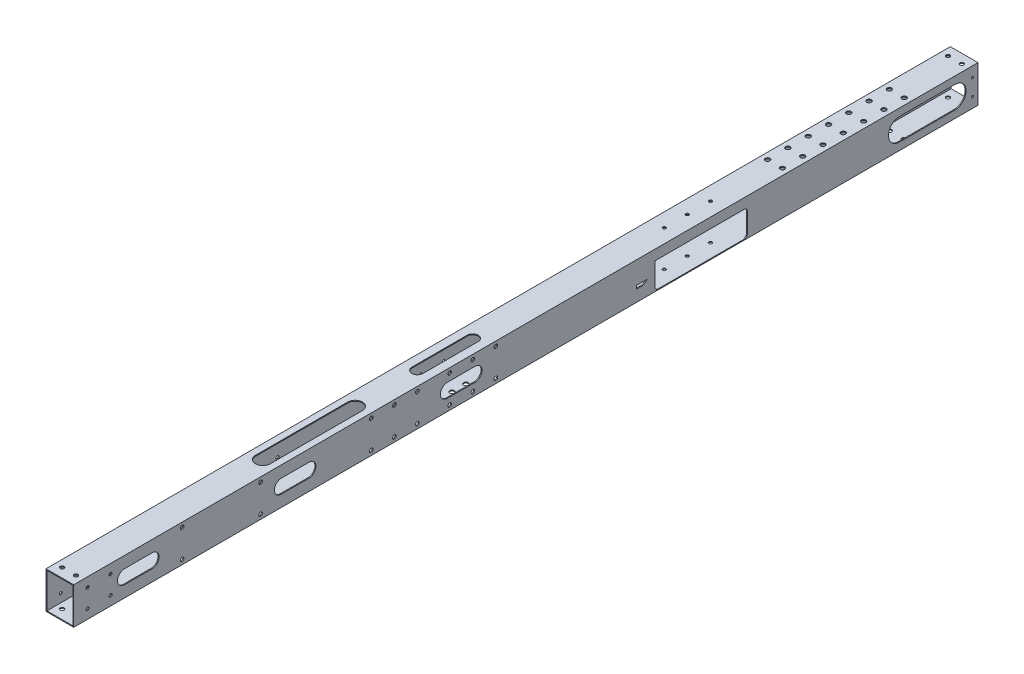
from build123d import *

# Parameters (mm, degrees)
SKETCH_1_W             = 30
SKETCH_1_H             = 40
SKETCH_1_W_2           = 28
SKETCH_1_H_2           = 38
EXTRUDE_1_DEPTH        = 940
SKETCH_5_R             = 2.5
CUT_EXTRUDE_3_DEPTH    = 941.97024395
CUT_EXTRUDE_4_DEPTH    = 1
SKETCH_7_R             = 1.75
CUT_EXTRUDE_5_DEPTH    = 1
SKETCH_17_W            = 30
SKETCH_17_H            = 40
SKETCH_17_W_2          = 28
SKETCH_17_H_2          = 38
EXTRUDE_2_DEPTH        = 20
SKETCH_18_W            = 30
SKETCH_18_H            = 40
SKETCH_18_W_2          = 28
SKETCH_18_H_2          = 38
EXTRUDE_3_DEPTH        = 20
SKETCH_19_R            = 2.1
CUT_EXTRUDE_16_DEPTH   = 961.950050731
SKETCH_20_R            = 1.6
CUT_EXTRUDE_17_DEPTH   = 961.67684473
SKETCH_23_R            = 2.5
CUT_EXTRUDE_19_DEPTH   = 961.950050731
SKETCH_24_R            = 4.5
CUT_EXTRUDE_20_DEPTH   = 10
SKETCH_26_R            = 2
CUT_EXTRUDE_22_DEPTH   = 961.67684473
CUT_EXTRUDE_28_DEPTH   = 10
PATTERN_LINEAR_4_COUNT = 2
PATTERN_LINEAR_4_PITCH = 255
PATTERN_LINEAR_8_COUNT = 2
PATTERN_LINEAR_8_PITCH = 205
PATTERN_LINEAR_9_COUNT = 2
PATTERN_LINEAR_9_PITCH = 230
CUT_EXTRUDE_START      = -20
SKETCH_34_R            = 1.75
CUT_EXTRUDE_29_DEPTH   = 20
SKETCH_35_R            = 1.5
CUT_EXTRUDE_30_DEPTH   = 10
CUT_EXTRUDE_31_DEPTH   = 10
SKETCH_37_R            = 1.65
CUT_EXTRUDE_32_DEPTH   = 52
SKETCH_39_R            = 1.75
CUT_EXTRUDE_33_DEPTH   = 10
SKETCH_40_W            = 100
SKETCH_40_H            = 28
CUT_EXTRUDE_34_DEPTH   = 10
EXTRUDE_5_DEPTH        = 1
SKETCH_43_W            = 38.522995696
SKETCH_43_H            = 13.00002022
EXTRUDE_6_DEPTH        = 1
FILLET_1_R             = 3
CUT_EXTRUDE_35_DEPTH   = 10
SKETCH_45_R            = 1.1
CUT_EXTRUDE_36_DEPTH   = 71
CUT_EXTRUDE_37_DEPTH   = 10


with BuildPart() as part:
    # 草图1 → 凸台-拉伸1 (new body)
    with BuildSketch(Plane.XY):
        Rectangle(SKETCH_1_W, SKETCH_1_H)
        Rectangle(SKETCH_1_W_2, SKETCH_1_H_2, mode=Mode.SUBTRACT)
    extrude(amount=EXTRUDE_1_DEPTH)

    # 草图5 → 切除-拉伸3 (cut, through all)
    with BuildSketch(Plane.XZ.offset(20)):
        with Locations((-8, 53)):
            Circle(SKETCH_5_R)
        with Locations((8, 53)):
            Circle(SKETCH_5_R)
        with Locations((-8, 97)):
            Circle(SKETCH_5_R)
        with Locations((8, 97)):
            Circle(SKETCH_5_R)
        with Locations((-8, 119)):
            Circle(SKETCH_5_R)
        with Locations((8, 119)):
            Circle(SKETCH_5_R)
        with Locations((-8, 141)):
            Circle(SKETCH_5_R)
        with Locations((8, 141)):
            Circle(SKETCH_5_R)
        with Locations((-8, 163)):
            Circle(SKETCH_5_R)
        with Locations((8, 163)):
            Circle(SKETCH_5_R)
        with Locations((-8, 185)):
            Circle(SKETCH_5_R)
        with Locations((8, 185)):
            Circle(SKETCH_5_R)
        with Locations((-8, 75)):
            Circle(SKETCH_5_R)
        with Locations((8, 75)):
            Circle(SKETCH_5_R)
    extrude(amount=-CUT_EXTRUDE_3_DEPTH, mode=Mode.SUBTRACT)

    # 草图6 → 切除-拉伸4 (cut)
    with BuildSketch(Plane(origin=(15, 0, 0), x_dir=(0, 0, -1), z_dir=(1, 0, 0))):
        with BuildLine():
            Line((-345, -7.5), (-375, -7.5))
            ThreePointArc((-375, -7.5), (-382.5, 0), (-375, 7.5))
            Line((-375, 7.5), (-345, 7.5))
            ThreePointArc((-345, 7.5), (-337.5, 0), (-345, -7.5))
        make_face()
        with BuildLine():
            Line((-525, -7.5), (-555, -7.5))
            ThreePointArc((-555, -7.5), (-562.5, 0), (-555, 7.5))
            Line((-555, 7.5), (-525, 7.5))
            ThreePointArc((-525, 7.5), (-517.5, 0), (-525, -7.5))
        make_face()
        with BuildLine():
            Line((-705, -7.5), (-735, -7.5))
            ThreePointArc((-735, -7.5), (-742.5, 0), (-735, 7.5))
            Line((-735, 7.5), (-705, 7.5))
            ThreePointArc((-705, 7.5), (-697.5, 0), (-705, -7.5))
        make_face()
    extrude(amount=-CUT_EXTRUDE_4_DEPTH, mode=Mode.SUBTRACT)

    # 草图7 → 切除-拉伸5 (cut)
    with BuildSketch(Plane.ZY.offset(15)):
        with Locations((350, 0)):
            Circle(SKETCH_7_R)
        with Locations((375, 0)):
            Circle(SKETCH_7_R)
        with Locations((530, 0)):
            Circle(SKETCH_7_R)
        with Locations((555, 0)):
            Circle(SKETCH_7_R)
        with Locations((710, 0)):
            Circle(SKETCH_7_R)
        with Locations((735, 0)):
            Circle(SKETCH_7_R)
    extrude(amount=-CUT_EXTRUDE_5_DEPTH, mode=Mode.SUBTRACT)

    # 草图17 → 凸台-拉伸2 (add)
    with BuildSketch(Plane.XY.offset(940)):
        Rectangle(SKETCH_17_W, SKETCH_17_H)
        Rectangle(SKETCH_17_W_2, SKETCH_17_H_2, mode=Mode.SUBTRACT)
    extrude(amount=EXTRUDE_2_DEPTH)

    # 草图18 → 凸台-拉伸3 (add)
    with BuildSketch(Plane(origin=(0, 0, 0), x_dir=(-1, 0, 0), z_dir=(0, 0, -1))):
        Rectangle(SKETCH_18_W, SKETCH_18_H)
        Rectangle(SKETCH_18_W_2, SKETCH_18_H_2, mode=Mode.SUBTRACT)
    extrude(amount=EXTRUDE_3_DEPTH)

    # 草图19 → 切除-拉伸16 (cut, through all)
    with BuildSketch(Plane(origin=(0, 20, 0), x_dir=(1, 0, 0), z_dir=(0, 1, 0))):
        with Locations((-7.5, -950)):
            Circle(SKETCH_19_R)
        with Locations((7.5, -950)):
            Circle(SKETCH_19_R)
        with Locations((-7.5, 10)):
            Circle(SKETCH_19_R)
        with Locations((7.5, 10)):
            Circle(SKETCH_19_R)
    extrude(amount=-CUT_EXTRUDE_16_DEPTH, mode=Mode.SUBTRACT)

    # 草图20 → 切除-拉伸17 (cut, through all)
    with BuildSketch(Plane(origin=(15, 0, 0), x_dir=(0, 0, -1), z_dir=(1, 0, 0))):
        with Locations((-945, 10)):
            Circle(SKETCH_20_R)
        with Locations((-920, 10)):
            Circle(SKETCH_20_R)
        with Locations((-920, -10)):
            Circle(SKETCH_20_R)
        with Locations((-945, -10)):
            Circle(SKETCH_20_R)
    extrude(amount=-CUT_EXTRUDE_17_DEPTH, mode=Mode.SUBTRACT)

    # 草图23 → 切除-拉伸19 (cut, through all)
    with BuildSketch(Plane(origin=(0, 20, 0), x_dir=(1, 0, 0), z_dir=(0, 1, 0))):
        with Locations((0, -520)):
            Circle(SKETCH_23_R)
        with Locations((0, -535)):
            Circle(SKETCH_23_R)
        with Locations((0, -550)):
            Circle(SKETCH_23_R)
        with Locations((0, -565)):
            Circle(SKETCH_23_R)
    extrude(amount=-CUT_EXTRUDE_19_DEPTH, mode=Mode.SUBTRACT)

    # 草图24 → 切除-拉伸20 (cut)
    with BuildSketch(Plane(origin=(0, 20, 0), x_dir=(1, 0, 0), z_dir=(0, 1, 0))):
        with Locations((0, -520)):
            Circle(SKETCH_24_R)
        with Locations((0, -535)):
            Circle(SKETCH_24_R)
        with Locations((0, -550)):
            Circle(SKETCH_24_R)
        with Locations((0, -565)):
            Circle(SKETCH_24_R)
    extrude(amount=-CUT_EXTRUDE_20_DEPTH, mode=Mode.SUBTRACT)

    # 草图26 → 切除-拉伸22 (cut, through all)
    with BuildSketch(Plane(origin=(15, 0, 0), x_dir=(0, 0, -1), z_dir=(1, 0, 0))):
        with Locations((-842.5, 15)):
            Circle(SKETCH_26_R)
        with Locations((-842.5, -15)):
            Circle(SKETCH_26_R)
        with Locations((-757.5, -15)):
            Circle(SKETCH_26_R)
        with Locations((-757.5, 15)):
            Circle(SKETCH_26_R)
    cut_extrude_22 = extrude(amount=-CUT_EXTRUDE_22_DEPTH, mode=Mode.SUBTRACT)

    # 草图33 → 切除-拉伸28 (cut)
    with BuildSketch(Plane(origin=(0, 20, 0), x_dir=(1, 0, 0), z_dir=(0, 1, 0))):
        with BuildLine():
            Line((6, -512.5), (6, -572.5))
            ThreePointArc((6, -572.5), (0, -578.5), (-6, -572.5))
            Line((-6, -572.5), (-6, -512.5))
            ThreePointArc((-6, -512.5), (0, -506.5), (6, -512.5))
        make_face()
    extrude(amount=-CUT_EXTRUDE_28_DEPTH, mode=Mode.SUBTRACT)

    # 阵列(线性)4: 切除-拉伸22 ×2
    with Locations(*[(0, 0, -i * PATTERN_LINEAR_4_PITCH) for i in range(1, PATTERN_LINEAR_4_COUNT)]):
        add(cut_extrude_22, mode=Mode.SUBTRACT)

    # 阵列(线性)8: 切除-拉伸22 ×2
    with Locations(*[(0, 0, -i * PATTERN_LINEAR_8_PITCH) for i in range(1, PATTERN_LINEAR_8_COUNT)]):
        add(cut_extrude_22, mode=Mode.SUBTRACT)

    # 阵列(线性)9: 切除-拉伸22 ×2
    with Locations(*[(0, 0, -i * PATTERN_LINEAR_9_PITCH) for i in range(1, PATTERN_LINEAR_9_COUNT)]):
        add(cut_extrude_22, mode=Mode.SUBTRACT)

    # 草图34 → 切除-拉伸29 (cut)
    with BuildSketch(Plane(origin=(15, 0, 0), x_dir=(0, 0, -1), z_dir=(1, 0, 0)).offset(CUT_EXTRUDE_START)):
        with Locations((-905, 0)):
            Circle(SKETCH_34_R)
        with Locations((-880, 0)):
            Circle(SKETCH_34_R)
    extrude(amount=-CUT_EXTRUDE_29_DEPTH, mode=Mode.SUBTRACT)

    # 草图35 → 切除-拉伸30 (cut)
    with BuildSketch(Plane.XZ.offset(20)):
        with Locations((5, 720)):
            Circle(SKETCH_35_R)
        with Locations((5, 700)):
            Circle(SKETCH_35_R)
        with Locations((5, 680)):
            Circle(SKETCH_35_R)
        with Locations((5, 660)):
            Circle(SKETCH_35_R)
        with Locations((5, 640)):
            Circle(SKETCH_35_R)
        with Locations((5, 740)):
            Circle(SKETCH_35_R)
    extrude(amount=-CUT_EXTRUDE_30_DEPTH, mode=Mode.SUBTRACT)

    # 草图36 → 切除-拉伸31 (cut)
    with BuildSketch(Plane(origin=(0, 20, 0), x_dir=(1, 0, 0), z_dir=(0, 1, 0))):
        with BuildLine():
            Line((8, -640), (8, -740))
            ThreePointArc((8, -740), (0, -748), (-8, -740))
            Line((-8, -740), (-8, -640))
            ThreePointArc((-8, -640), (0, -632), (8, -640))
        make_face()
    extrude(amount=-CUT_EXTRUDE_31_DEPTH, mode=Mode.SUBTRACT)

    # 草图37 → 切除-拉伸32 (cut)
    with BuildSketch(Plane(origin=(0, 20, 0), x_dir=(1, 0, 0), z_dir=(0, 1, 0))):
        with Locations((0, -255)):
            Circle(SKETCH_37_R)
        with Locations((0, -280)):
            Circle(SKETCH_37_R)
        with Locations((0, -305)):
            Circle(SKETCH_37_R)
    extrude(amount=-CUT_EXTRUDE_32_DEPTH, mode=Mode.SUBTRACT)

    # 草图39 → 切除-拉伸33 (cut)
    with BuildSketch(Plane.XZ.offset(20)):
        with Locations((0, 162)):
            Circle(SKETCH_39_R)
        with Locations((0, 187)):
            Circle(SKETCH_39_R)
    extrude(amount=-CUT_EXTRUDE_33_DEPTH, mode=Mode.SUBTRACT)

    # 草图40 → 切除-拉伸34 (cut)
    with BuildSketch(Plane(origin=(15, 0, 0), x_dir=(0, 0, -1), z_dir=(1, 0, 0))):
        with Locations((-280, -5)):
            Rectangle(SKETCH_40_W, SKETCH_40_H)
    extrude(amount=-CUT_EXTRUDE_34_DEPTH, mode=Mode.SUBTRACT)

    # 草图42 → 凸台-拉伸5 (add)
    with BuildSketch(Plane(origin=(15, 0, 0), x_dir=(0, 0, -1), z_dir=(1, 0, 0))):
        Polygon((-350, -8.24794841), (-350, -4), (-334.23295051, -4), (-334.23295051, 12.222841732), (-383.610977641, 12.222841732), (-383.610977641, -8.24794841), align=None)
    extrude(amount=-EXTRUDE_5_DEPTH)

    # 草图43 → 凸台-拉伸6 (add)
    with BuildSketch(Plane.ZY.offset(15)):
        with Locations((362.400416305, 1.435266839)):
            Rectangle(SKETCH_43_W, SKETCH_43_H)
    extrude(amount=-EXTRUDE_6_DEPTH)

    # 圆角1
    fillet_1_edges = [part.edges().sort_by_distance(p)[0] for p in [
        (14.5, -19, 230),
        (14.5, 9, 230),
        (14.5, -19, 330),
    ]]
    fillet(fillet_1_edges, radius=FILLET_1_R)

    # 草图44 → 切除-拉伸35 (cut)
    with BuildSketch(Plane(origin=(15, 0, 0), x_dir=(0, 0, -1), z_dir=(1, 0, 0))):
        with BuildLine():
            ThreePointArc((-875, -7.5), (-867.5, 0), (-875, 7.5))
            Line((-875, 7.5), (-905, 7.5))
            ThreePointArc((-905, 7.5), (-912.5, 0), (-905, -7.5))
            Line((-905, -7.5), (-875, -7.5))
        make_face()
    extrude(amount=-CUT_EXTRUDE_35_DEPTH, mode=Mode.SUBTRACT)

    # 草图45 → 切除-拉伸36 (cut)
    with BuildSketch(Plane(origin=(15, 0, 0), x_dir=(0, 0, -1), z_dir=(1, 0, 0))):
        with Locations((-31.199995376, 9.020444537)):
            Circle(SKETCH_45_R)
        with Locations((14, 9)):
            Circle(SKETCH_45_R)
        with Locations((14, -9)):
            Circle(SKETCH_45_R)
        with Locations((-31.199995376, -9.020444537)):
            Circle(SKETCH_45_R)
    extrude(amount=-CUT_EXTRUDE_36_DEPTH, mode=Mode.SUBTRACT)

    # 草图46 → 切除-拉伸37 (cut)
    with BuildSketch(Plane(origin=(15, 0, 0), x_dir=(0, 0, -1), z_dir=(1, 0, 0))):
        with BuildLine():
            Line((-65, 12), (-5, 12))
            ThreePointArc((-5, 12), (7, 0), (-5, -12))
            Line((-5, -12), (-65, -12))
            ThreePointArc((-65, -12), (-77, 0), (-65, 12))
        make_face()
    extrude(amount=-CUT_EXTRUDE_37_DEPTH, mode=Mode.SUBTRACT)


solid = part.part
